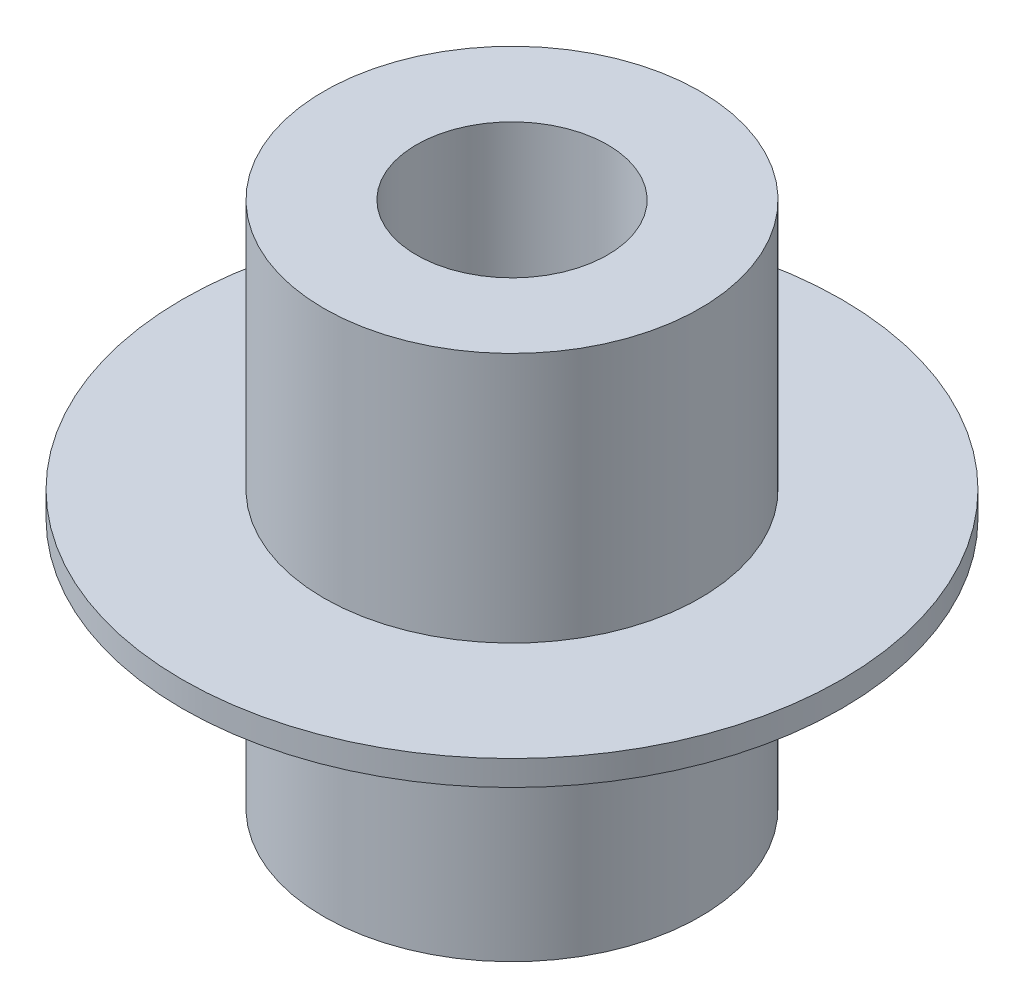
from build123d import *


with BuildPart() as part:
    # Sketch1 → Revolve1 (revolve)
    with BuildSketch(Plane.XY):
        Polygon((-3.81, -6.226635514), (-3.81, 14.773364486), (-7.5, 14.773364486), (-7.5, 4.773364486), (-13.135514019, 4.773364486), (-13.135514019, 3.773364486), (-7.5, 3.773364486), (-7.5, -6.226635514), align=None)
    revolve(axis=Axis((0, 0, 0), (0, 1, 0)))


solid = part.part
